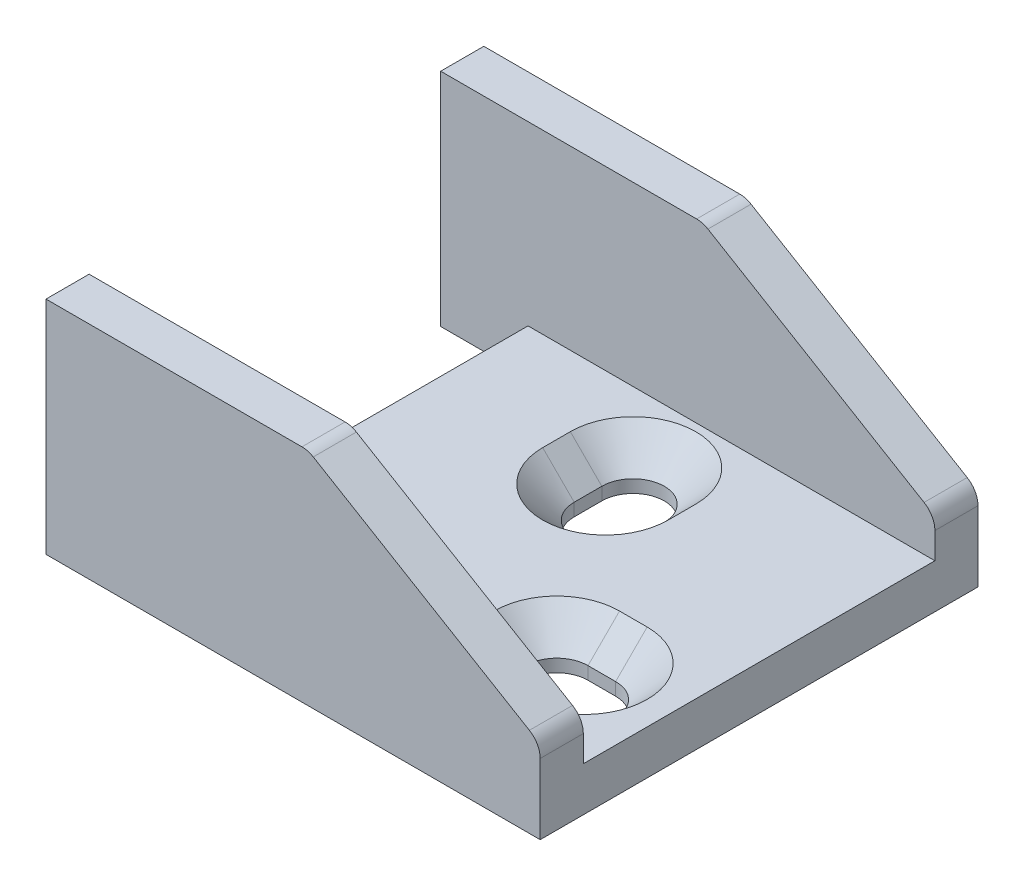
from build123d import *

# Parameters (mm, degrees)
SKETCH1_W           = 36.8
SKETCH1_H           = 39.6
BOSS_EXTRUDE1_DEPTH = 4
SKETCH2_W           = 44.7
SKETCH2_H           = 3.9
BOSS_EXTRUDE2_DEPTH = 20
CUT_EXTRUDE1_REACH  = 58.377
CHAMFER1_SIZE       = 2.85
CUT_EXTRUDE2_DEPTH  = 58.640263705
FILLET1_R           = 2


with BuildPart() as part:
    # Sketch1 → Boss-Extrude1 (new body)
    with BuildSketch(Plane(origin=(0, 0, 0), x_dir=(1, 0, 0), z_dir=(0, 1, 0))):
        with Locations((18.4, 19.8)):
            Rectangle(SKETCH1_W, SKETCH1_H)
    extrude(amount=BOSS_EXTRUDE1_DEPTH)

    # Sketch2 → Boss-Extrude2 (add)
    with BuildSketch(Plane(origin=(0, 0, 0), x_dir=(1, 0, 0), z_dir=(0, 1, 0))):
        with Locations((14.45, 37.65)):
            Rectangle(SKETCH2_W, SKETCH2_H)
        with Locations((14.45, 1.95)):
            Rectangle(SKETCH2_W, SKETCH2_H)
    extrude(amount=BOSS_EXTRUDE2_DEPTH)

    # Sketch3 → Cut-Extrude1 (cut, up to next)
    with BuildSketch(Plane(origin=(0, 4, 0), x_dir=(1, 0, 0), z_dir=(0, 1, 0)), mode=Mode.PRIVATE) as cut_extrude1_sk1:
        with BuildLine():
            Line((26.475, 14.65), (28.975, 14.65))
            ThreePointArc((28.975, 14.65), (31.8, 11.825), (28.975, 9))
            Line((28.975, 9), (26.475, 9))
            ThreePointArc((26.475, 9), (23.65, 11.825), (26.475, 14.65))
        make_face()
    cut_extrude1_tool1 = extrude(cut_extrude1_sk1.sketch, amount=-CUT_EXTRUDE1_REACH, mode=Mode.PRIVATE) & part.part
    # Sketch3 → Cut-Extrude1 (cut, up to next)
    with BuildSketch(Plane(origin=(0, 4, 0), x_dir=(1, 0, 0), z_dir=(0, 1, 0)), mode=Mode.PRIVATE) as cut_extrude1_sk2:
        with BuildLine():
            Line((18.7, 29.325), (18.7, 26.825))
            ThreePointArc((18.7, 26.825), (15.875, 24), (13.05, 26.825))
            Line((13.05, 26.825), (13.05, 29.325))
            ThreePointArc((13.05, 29.325), (15.875, 32.15), (18.7, 29.325))
        make_face()
    cut_extrude1_tool2 = extrude(cut_extrude1_sk2.sketch, amount=-CUT_EXTRUDE1_REACH, mode=Mode.PRIVATE) & part.part
    add(cut_extrude1_tool1.solids().sort_by_distance((27.725, 4, -11.825))[0], mode=Mode.SUBTRACT)
    add(cut_extrude1_tool2.solids().sort_by_distance((15.875, 4, -28.075))[0], mode=Mode.SUBTRACT)

    # Chamfer1
    chamfer1_edges = [part.edges().sort_by_distance(p)[0] for p in [
        (23.65, 4, -11.825),
        (27.725, 4, -9),
        (31.8, 4, -11.825),
        (27.725, 4, -14.65),
        (13.05, 4, -28.075),
        (15.875, 4, -24),
        (18.7, 4, -28.075),
        (15.875, 4, -32.15),
    ]]
    chamfer(chamfer1_edges, length=CHAMFER1_SIZE)

    # Sketch4 → Cut-Extrude2 (cut, through all)
    with BuildSketch(Plane(origin=(0, 0, -39.6), x_dir=(-1, 0, 0), z_dir=(0, 0, -1))):
        Polygon((-36.8, 20), (-36.8, 7.5), (-15.8, 20), align=None)
    extrude(amount=-CUT_EXTRUDE2_DEPTH, mode=Mode.SUBTRACT)

    # Fillet1
    fillet1_edges = [part.edges().sort_by_distance(p)[0] for p in [
        (36.8, 7.5, -1.95),
        (36.8, 7.5, -37.65),
        (15.8, 20, -37.65),
        (15.8, 20, -1.95),
    ]]
    fillet(fillet1_edges, radius=FILLET1_R)


solid = part.part
